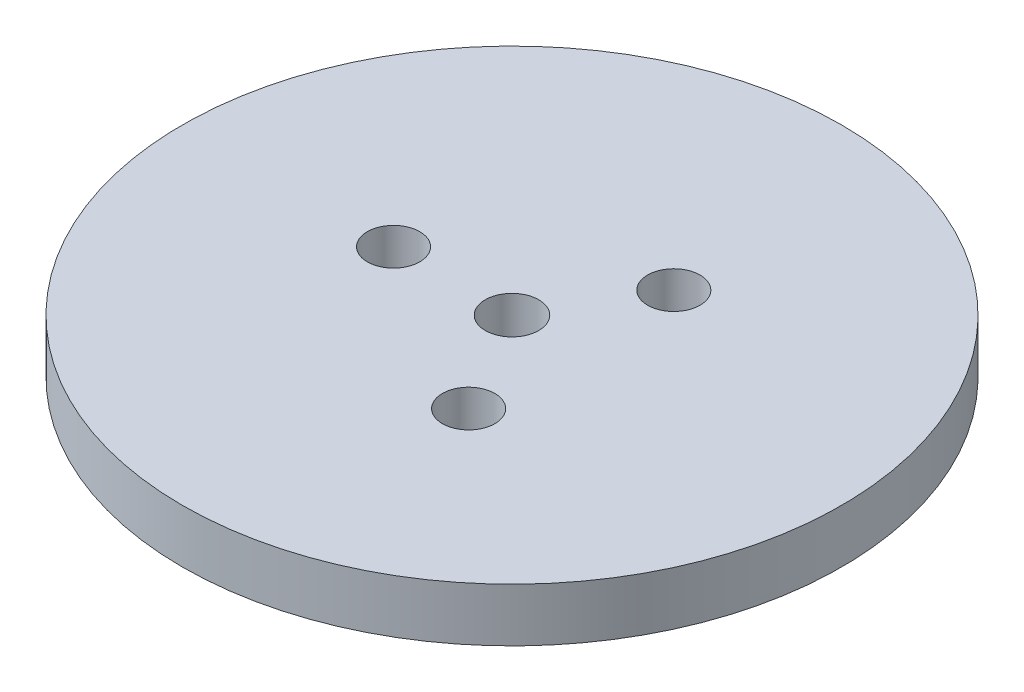
from build123d import *

# Parameters (mm, degrees)
SKETCH1_R           = 92.5
BOSS_EXTRUDE1_DEPTH = 15
SKETCH2_R           = 7.5
CUT_EXTRUDE1_DEPTH  = 132.671940823
SKETCH3_R           = 7.356937121
CUT_EXTRUDE2_DEPTH  = 14.275684289
CIRPATTERN1_COUNT   = 3


with BuildPart() as part:
    # Sketch1 → Boss-Extrude1 (new body)
    with BuildSketch(Plane(origin=(0, 0, 0), x_dir=(1, 0, 0), z_dir=(0, 1, 0))):
        Circle(SKETCH1_R)
    extrude(amount=BOSS_EXTRUDE1_DEPTH)

    # Sketch2 → Cut-Extrude1 (cut, through all)
    with BuildSketch(Plane(origin=(0, 0, 0), x_dir=(1, 0, 0), z_dir=(0, 1, 0))):
        Circle(SKETCH2_R)
    extrude(amount=CUT_EXTRUDE1_DEPTH, mode=Mode.SUBTRACT)

    # Sketch3 → Cut-Extrude2 (cut)
    with BuildSketch(Plane(origin=(0, 15, 0), x_dir=(1, 0, 0), z_dir=(0, 1, 0))):
        with Locations((-33.24684245, 0)):
            Circle(SKETCH3_R)
    cut_extrude2 = extrude(amount=-CUT_EXTRUDE2_DEPTH, mode=Mode.SUBTRACT)

    # CirPattern1: Cut-Extrude2 ×3 about axis
    cirpattern1_axis = Axis((0, 0, 0), (0, 1, 0))
    for i in range(1, CIRPATTERN1_COUNT):
        add(cut_extrude2.rotate(cirpattern1_axis, i * 360 / CIRPATTERN1_COUNT), mode=Mode.SUBTRACT)


solid = part.part
